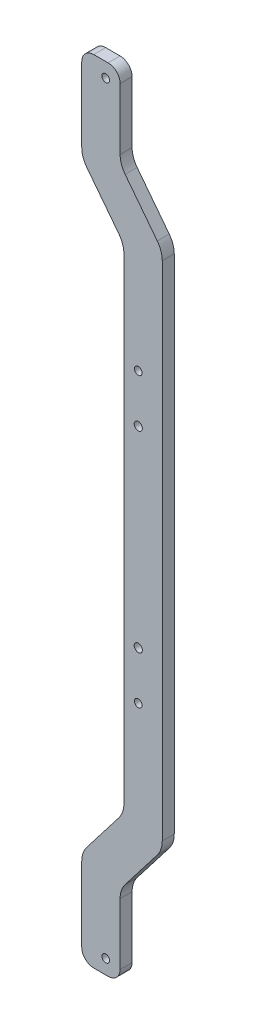
from build123d import *

# Parameters (mm, degrees)
SKETCH_2_R      = 1.701479418
SKETCH_2_R_2    = 1.6
EXTRUDE_1_DEPTH = 5


with BuildPart() as part:
    # 草图2 → 凸台-拉伸1 (new body)
    with BuildSketch(Plane.XY):
        with BuildLine():
            ThreePointArc((-16, -97.901860305), (-16.53506435, -101.129087155), (-18.082998629, -104.010959198))
            Line((-18.082998629, -104.010959198), (-31.481692021, -121.374808727))
            ThreePointArc((-31.481692021, -121.374808727), (-33.0296263, -124.25668077), (-33.56469065, -127.48390762))
            Line((-33.56469065, -127.48390762), (-33.56469065, -158.518354508))
            ThreePointArc((-33.56469065, -158.518354508), (-32.100224556, -162.053888414), (-28.56469065, -163.518354508))
            Line((-28.56469065, -163.518354508), (-22.56469065, -163.518354508))
            ThreePointArc((-22.56469065, -163.518354508), (-19.029156744, -162.053888414), (-17.56469065, -158.518354508))
            Line((-17.56469065, -158.518354508), (-17.56469065, -132.93937309))
            ThreePointArc((-17.56469065, -132.93937309), (-17.0296263, -129.71214624), (-15.481692021, -126.830274196))
            Line((-15.481692021, -126.830274196), (-2.082998629, -109.466424668))
            ThreePointArc((-2.082998629, -109.466424668), (-0.53506435, -106.584552625), (0, -103.357325774))
            Line((0, -103.357325774), (0, 106.104252201))
            ThreePointArc((0, 106.104252201), (-0.53506435, 109.331479052), (-2.082998629, 112.213351095))
            Line((-2.082998629, 112.213351095), (-15.481692021, 129.577200623))
            ThreePointArc((-15.481692021, 129.577200623), (-17.0296263, 132.459072666), (-17.56469065, 135.686299517))
            Line((-17.56469065, 135.686299517), (-17.56469065, 161.265280935))
            ThreePointArc((-17.56469065, 161.265280935), (-19.029156744, 164.800814841), (-22.56469065, 166.265280935))
            Line((-22.56469065, 166.265280935), (-28.56469065, 166.265280935))
            ThreePointArc((-28.56469065, 166.265280935), (-32.100224556, 164.800814841), (-33.56469065, 161.265280935))
            Line((-33.56469065, 161.265280935), (-33.56469065, 130.230834047))
            ThreePointArc((-33.56469065, 130.230834047), (-33.0296263, 127.003607197), (-31.481692021, 124.121735153))
            Line((-31.481692021, 124.121735153), (-18.082998629, 106.757885625))
            ThreePointArc((-18.082998629, 106.757885625), (-16.53506435, 103.876013582), (-16, 100.648786731))
            Line((-16, 100.648786731), (-16, -97.901860305))
        make_face()
        with Locations((-10.001107286, -38.626536787)):
            Circle(SKETCH_2_R, mode=Mode.SUBTRACT)
        with Locations((-23.56469065, 160.265280935)):
            Circle(SKETCH_2_R_2, mode=Mode.SUBTRACT)
        with Locations((-10.001107286, 41.373463213)):
            Circle(SKETCH_2_R, mode=Mode.SUBTRACT)
        with Locations((-10.001107286, 61.373463213)):
            Circle(SKETCH_2_R_2, mode=Mode.SUBTRACT)
        with Locations((-10.001107286, -58.626536787)):
            Circle(SKETCH_2_R_2, mode=Mode.SUBTRACT)
        with Locations((-23.56469065, -157.518354508)):
            Circle(SKETCH_2_R_2, mode=Mode.SUBTRACT)
    extrude(amount=EXTRUDE_1_DEPTH)


solid = part.part
